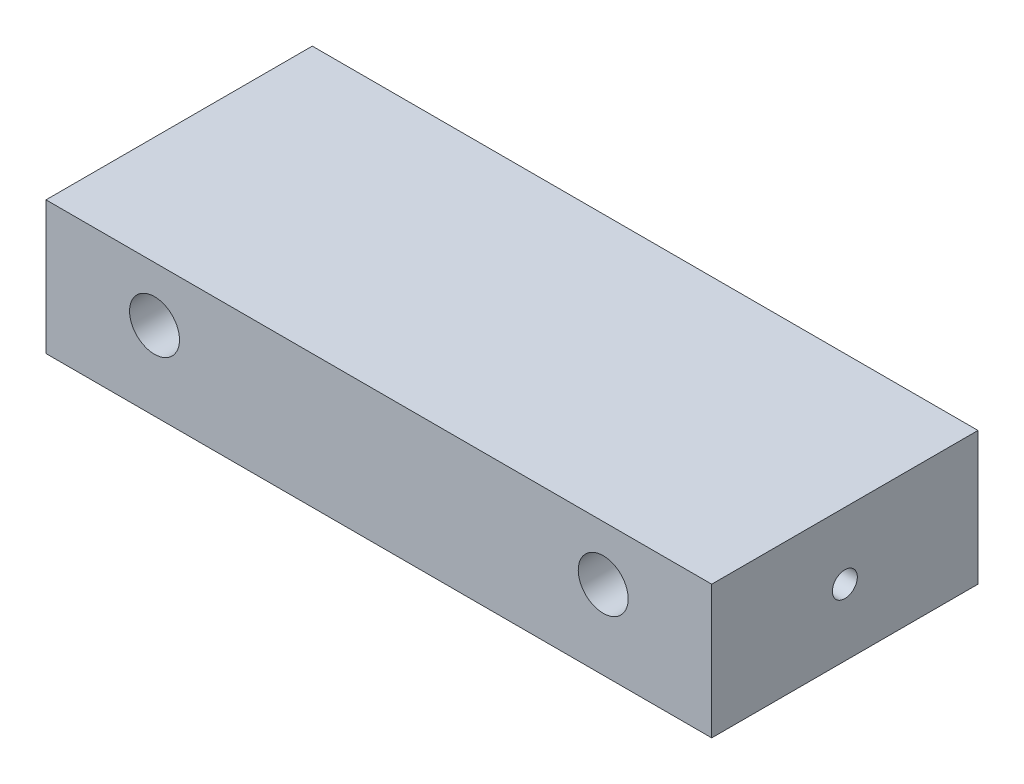
from build123d import *

# Parameters (mm, degrees)
SKETCH1_W           = 254
SKETCH1_H           = 50.8
BOSS_EXTRUDE1_DEPTH = 101.6
SKETCH2_R           = 9.525
CUT_EXTRUDE1_DEPTH  = 25.4
SKETCH3_R           = 4.7625
CUT_EXTRUDE2_DEPTH  = 25.4
SKETCH4_R           = 4.7625
CUT_EXTRUDE3_DEPTH  = 25.4
CUT_EXTRUDE4_START  = -25.4
SKETCH5_R           = 4.7625
CUT_EXTRUDE4_DEPTH  = 25.4


with BuildPart() as part:
    # Sketch1 → Boss-Extrude1 (new body)
    with BuildSketch(Plane.XY):
        Rectangle(SKETCH1_W, SKETCH1_H)
    extrude(amount=BOSS_EXTRUDE1_DEPTH)

    # Sketch2 → Cut-Extrude1 (cut)
    with BuildSketch(Plane.XY.offset(101.6)):
        with Locations((-85.598, 4.5974)):
            Circle(SKETCH2_R)
        with Locations((85.598, 4.5974)):
            Circle(SKETCH2_R)
    extrude(amount=-CUT_EXTRUDE1_DEPTH, mode=Mode.SUBTRACT)

    # Sketch3 → Cut-Extrude2 (cut)
    with BuildSketch(Plane(origin=(0, 0, 0), x_dir=(-1, 0, 0), z_dir=(0, 0, -1))):
        with Locations((-57.15, 0)):
            Circle(SKETCH3_R)
        with Locations((57.15, 0)):
            Circle(SKETCH3_R)
    extrude(amount=-CUT_EXTRUDE2_DEPTH, mode=Mode.SUBTRACT)

    # Sketch4 → Cut-Extrude3 (cut)
    with BuildSketch(Plane(origin=(127, 0, 0), x_dir=(0, 0, -1), z_dir=(1, 0, 0))):
        with Locations((-50.8, 0)):
            Circle(SKETCH4_R)
    extrude(amount=-CUT_EXTRUDE3_DEPTH, mode=Mode.SUBTRACT)

    # Sketch5 → Cut-Extrude4 (cut)
    with BuildSketch(Plane.ZY.offset(127).offset(CUT_EXTRUDE4_START)):
        with Locations((50.8, 0)):
            Circle(SKETCH5_R)
    extrude(amount=CUT_EXTRUDE4_DEPTH, mode=Mode.SUBTRACT)


solid = part.part
